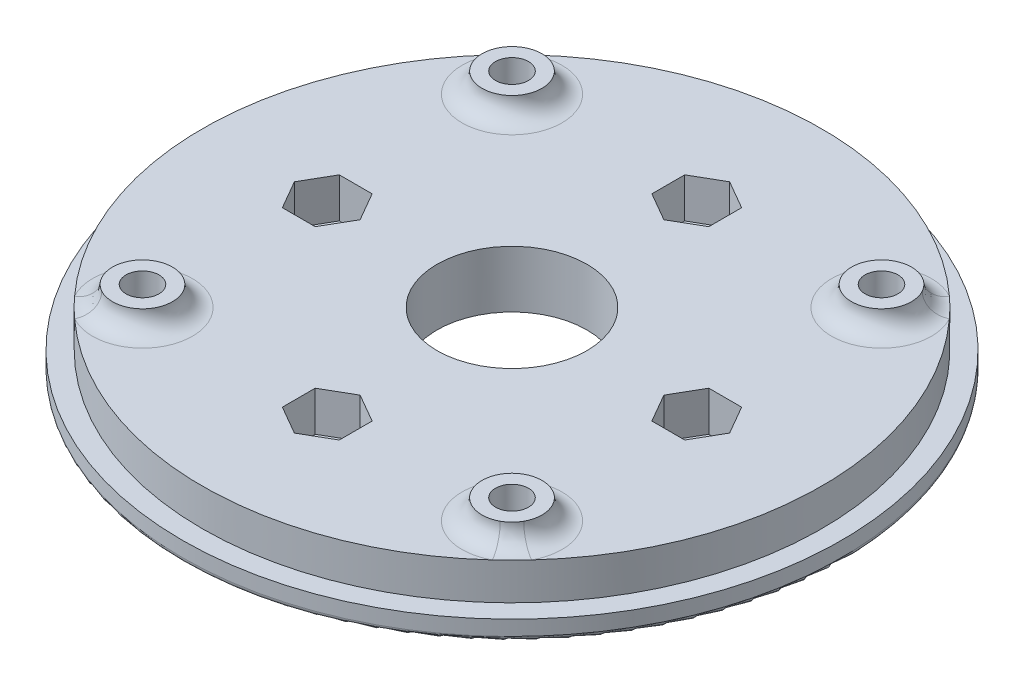
from build123d import *
from build123d.topology import SkipClean

# Parameters (mm, degrees)
SKETCH1_R               = 33
BOSS_EXTRUDE1_DEPTH     = 2
SKETCH4_R               = 31
BOSS_EXTRUDE3_DEPTH     = 3.7
SKETCH5_R               = 1.65
CUT_EXTRUDE1_DEPTH      = 48.015848392
MIRROR4_COPY_1_SKETCH_R = 1.65
MIRROR4_COPY_1_DEPTH    = 48.015848392
SKETCH6_R               = 3
CUT_EXTRUDE2_DEPTH      = 3.5
MIRROR6_COPY_1_SKETCH_R = 3
MIRROR6_COPY_1_DEPTH    = 3.5
FILLET2_R               = 0.5
CUT_EXTRUDE3_DEPTH      = 0.5
BOSS_EXTRUDE4_DEPTH     = 0.2
BOSS_EXTRUDE4_2_DEPTH   = 0.2
MIRROR14_COPY_1_DEPTH   = 0.5
MIRROR18_COPY_1_DEPTH   = 0.2
MIRROR18_COPY_2_DEPTH   = 0.2
BOSS_EXTRUDE5_START     = 2
SKETCH9_R               = 3.001958177
SKETCH9_R_2             = 1.65
BOSS_EXTRUDE5_DEPTH     = 2
CIRPATTERN1_COUNT       = 4
FILLET3_R               = 2
ESBO_O3_R               = 1.8
CORTE_EXTRUS_O2_DEPTH   = 48.015848462
ESPELHAR3_OUTLINE_R     = 1.8
ESPELHAR3_DEPTH         = 5.7
CORTE_EXTRUS_O11_DEPTH  = 3.5
CORTE_EXTRUS_O12_DEPTH  = 0.3
ESBO_O43_W              = 3.6
ESBO_O43_H              = 3.6
CORTE_EXTRUS_O13_DEPTH  = 0.2
ESBO_O44_R              = 7.5
CORTE_EXTRUS_O14_DEPTH  = 48.300000086
CORTE_EXTRUS_O15_DEPTH  = 4
CORTE_EXTRUS_O16_DEPTH  = 4


# Read off the part's stored shape, not the designer's step: Espelhar3
with BuildPart() as part:
    # Sketch1 → Boss-Extrude1 (new body)
    with BuildSketch(Plane(origin=(0, 0, 0), x_dir=(1, 0, 0), z_dir=(0, 1, 0))):
        with Locations(Location((0, 0, 0), (0, 0, 270))):
            Circle(SKETCH1_R)
    extrude(amount=BOSS_EXTRUDE1_DEPTH)

    # Sketch4 → Boss-Extrude3 (add)
    with BuildSketch(Plane(origin=(0, 2, 0), x_dir=(1, 0, 0), z_dir=(0, 1, 0))):
        with Locations(Location((0, 0, 0), (0, 0, 270))):
            Circle(SKETCH4_R)
    extrude(amount=BOSS_EXTRUDE3_DEPTH)

    # Sketch5 → Cut-Extrude1 (cut, through all)
    with BuildSketch(Plane(origin=(0, 5.7, 0), x_dir=(1, 0, 0), z_dir=(0, 1, 0))):
        with Locations(Location((18.5, 18.5, 0), (0, 0, 270))):
            Circle(SKETCH5_R)
    cut_extrude1 = extrude(amount=-CUT_EXTRUDE1_DEPTH, mode=Mode.SUBTRACT)

    # Mirror3: Cut-Extrude1 across plane
    add(cut_extrude1.mirror(Plane(origin=(0, 0, 0), x_dir=(0, 0, 1), z_dir=(1, 0, 0))), mode=Mode.SUBTRACT)

    # Mirror4: Cut-Extrude1 across plane
    add(cut_extrude1.mirror(Plane.XY), mode=Mode.SUBTRACT)

    # Mirror4 copy 1 sketch → Mirror4 copy 1 (cut, through all)
    with BuildSketch(Plane(origin=(0, 5.7, 0), x_dir=(-1, 0, 0), z_dir=(0, 1, 0))):
        with Locations(Location((18.5, 18.5, 0), (0, 0, 270))):
            Circle(MIRROR4_COPY_1_SKETCH_R)
    extrude(amount=-MIRROR4_COPY_1_DEPTH, mode=Mode.SUBTRACT)

    # Sketch6 → Cut-Extrude2 (cut)
    with BuildSketch(Plane.XZ):
        with Locations(Location((18.5, -18.5, 0), (0, 0, 270))):
            Circle(SKETCH6_R)
    cut_extrude2 = extrude(amount=-CUT_EXTRUDE2_DEPTH, mode=Mode.SUBTRACT)

    # Mirror5: Cut-Extrude2 across plane
    add(cut_extrude2.mirror(Plane(origin=(0, 0, 0), x_dir=(0, 0, 1), z_dir=(1, 0, 0))), mode=Mode.SUBTRACT)

    # Mirror6: Cut-Extrude2 across plane
    add(cut_extrude2.mirror(Plane.XY), mode=Mode.SUBTRACT)

    # Mirror6 copy 1 sketch → Mirror6 copy 1 (cut)
    with BuildSketch(Plane(origin=(0, 0, 0), x_dir=(-1, 0, 0), z_dir=(0, -1, 0))):
        with Locations(Location((18.5, -18.5, 0), (0, 0, 270))):
            Circle(MIRROR6_COPY_1_SKETCH_R)
    extrude(amount=-MIRROR6_COPY_1_DEPTH, mode=Mode.SUBTRACT)

    # Fillet2
    fillet2_edges = [part.edges().sort_by_distance(p)[0] for p in [
        (0, 0, -33),
    ]]
    fillet(fillet2_edges, radius=FILLET2_R)

    # Sketch7 → Cut-Extrude3 (cut)
    with BuildSketch(Plane.XZ.offset(-3.5)):
        with BuildLine():
            ThreePointArc((21.5, 18.5), (21.37371553, 19.36125435), (21.005493963, 20.15))
            Line((21.005493963, 20.15), (18.5, 20.15))
            ThreePointArc((18.5, 20.15), (19.666726189, 19.666726189), (20.15, 18.5))
            ThreePointArc((20.15, 18.5), (19.666726189, 17.333273811), (18.5, 16.85))
            Line((18.5, 16.85), (21.005493963, 16.85))
            ThreePointArc((21.005493963, 16.85), (21.37371553, 17.63874565), (21.5, 18.5))
        make_face()
        with BuildLine():
            ThreePointArc((18.5, 16.85), (16.85, 18.5), (18.5, 20.15))
            Line((18.5, 20.15), (15.994506037, 20.15))
            ThreePointArc((15.994506037, 20.15), (15.5, 18.5), (15.994506037, 16.85))
            Line((15.994506037, 16.85), (18.5, 16.85))
        make_face()
    cut_extrude3 = extrude(amount=-CUT_EXTRUDE3_DEPTH, mode=Mode.SUBTRACT)

    # Mirror11: Cut-Extrude3 across plane
    add(cut_extrude3.mirror(Plane.XY), mode=Mode.SUBTRACT)


with BuildPart() as body_2:
    # Sketch8 → Boss-Extrude4 (new body)
    with BuildSketch(Plane(origin=(0, 4, 0), x_dir=(-1, 0, 0), z_dir=(0, -1, 0))):
        with BuildLine():
            Line((-21.005493963, -20.15), (-20.15, -20.15))
            Line((-20.15, -20.15), (-20.15, -16.85))
            Line((-20.15, -16.85), (-21.005493963, -16.85))
            ThreePointArc((-21.005493963, -16.85), (-21.5, -18.5), (-21.005493963, -20.15))
        make_face()
    boss_extrude4 = extrude(amount=BOSS_EXTRUDE4_DEPTH)


with BuildPart() as body_3:
    # Sketch8 → Boss-Extrude4 2 (new body)
    with BuildSketch(Plane(origin=(0, 4, 0), x_dir=(-1, 0, 0), z_dir=(0, -1, 0))):
        with BuildLine():
            Line((-16.85, -16.85), (-16.85, -20.15))
            Line((-16.85, -20.15), (-15.994506037, -20.15))
            ThreePointArc((-15.994506037, -20.15), (-15.5, -18.5), (-15.994506037, -16.85))
            Line((-15.994506037, -16.85), (-16.85, -16.85))
        make_face()
    boss_extrude4_2 = extrude(amount=BOSS_EXTRUDE4_2_DEPTH)


with BuildPart() as part_1:
    add(part.part)

    # Mirror12: Boss-Extrude4, Boss-Extrude4 2 across plane
    add(boss_extrude4.mirror(Plane.XY))
    add(boss_extrude4_2.mirror(Plane.XY))

    # Mirror14: Cut-Extrude3 across plane
    with SkipClean():  # the faces are left unmerged after this step: merging them gives an invalid solid
        add(cut_extrude3.mirror(Plane(origin=(0, 0, 0), x_dir=(0, 0, 1), z_dir=(1, 0, 0))), mode=Mode.SUBTRACT)

    # Mirror14 copy 1 sketch → Mirror14 copy 1 (cut)
    with SkipClean():  # the faces are left unmerged after this step: merging them gives an invalid solid
        with BuildSketch(Plane(origin=(0, 3.5, 0), x_dir=(-1, 0, 0), z_dir=(0, -1, 0))):
            with BuildLine():
                ThreePointArc((21.5, 18.5), (21.37371553, 19.36125435), (21.005493963, 20.15))
                Line((21.005493963, 20.15), (18.5, 20.15))
                ThreePointArc((18.5, 20.15), (19.666726189, 19.666726189), (20.15, 18.5))
                ThreePointArc((20.15, 18.5), (19.666726189, 17.333273811), (18.5, 16.85))
                Line((18.5, 16.85), (21.005493963, 16.85))
                ThreePointArc((21.005493963, 16.85), (21.37371553, 17.63874565), (21.5, 18.5))
            make_face()
            with BuildLine():
                ThreePointArc((18.5, 16.85), (16.85, 18.5), (18.5, 20.15))
                Line((18.5, 20.15), (15.994506037, 20.15))
                ThreePointArc((15.994506037, 20.15), (15.5, 18.5), (15.994506037, 16.85))
                Line((15.994506037, 16.85), (18.5, 16.85))
            make_face()
        extrude(amount=-MIRROR14_COPY_1_DEPTH, mode=Mode.SUBTRACT)

    # Mirror18 copy 1 sketch → Mirror18 copy 1 (add)
    with SkipClean():  # the faces are left unmerged after this step: merging them gives an invalid solid
        with BuildSketch(Plane.XZ.offset(-4)):
            with BuildLine():
                Line((-21.005493963, -20.15), (-20.15, -20.15))
                Line((-20.15, -20.15), (-20.15, -16.85))
                Line((-20.15, -16.85), (-21.005493963, -16.85))
                ThreePointArc((-21.005493963, -16.85), (-21.5, -18.5), (-21.005493963, -20.15))
            make_face()
        extrude(amount=MIRROR18_COPY_1_DEPTH)

    # Mirror18 copy 2 sketch → Mirror18 copy 2 (add)
    with SkipClean():  # the faces are left unmerged after this step: merging them gives an invalid solid
        with BuildSketch(Plane.XZ.offset(-4)):
            with BuildLine():
                Line((-16.85, -16.85), (-16.85, -20.15))
                Line((-16.85, -20.15), (-15.994506037, -20.15))
                ThreePointArc((-15.994506037, -20.15), (-15.5, -18.5), (-15.994506037, -16.85))
                Line((-15.994506037, -16.85), (-16.85, -16.85))
            make_face()
        extrude(amount=MIRROR18_COPY_2_DEPTH)

    # Sketch9 → Boss-Extrude5 (add)
    with SkipClean():  # the faces are left unmerged after this step: merging them gives an invalid solid
        with BuildSketch(Plane(origin=(0, 5.7, 0), x_dir=(1, 0, 0), z_dir=(0, 1, 0)).offset(BOSS_EXTRUDE5_START)):
            with Locations(Location((18.5, 18.5, 0), (0, 0, 270))):
                Circle(SKETCH9_R)
            with Locations(Location((18.5, 18.5, 0), (0, 0, 270))):
                Circle(SKETCH9_R_2, mode=Mode.SUBTRACT)
        boss_extrude5 = extrude(amount=-BOSS_EXTRUDE5_DEPTH)

    # CirPattern1: Boss-Extrude5 ×4 about axis
    with SkipClean():  # the faces are left unmerged after this step: merging them gives an invalid solid
        cirpattern1_axis = Axis((0, 0, 0), (0, 1, 0))
        for i in range(1, CIRPATTERN1_COUNT):
            add(boss_extrude5.rotate(cirpattern1_axis, i * 360 / CIRPATTERN1_COUNT))

    # Fillet3
    fillet3_edges = [part_1.edges().sort_by_distance(p)[0] for p in [
        (18.5, 5.7, -21.501958177),
        (-21.501958177, 5.7, -18.5),
        (-18.5, 5.7, 21.501958177),
        (21.501958177, 5.7, 18.5),
    ]]
    fillet(fillet3_edges, radius=FILLET3_R - 0.0001)  # a hair under: the kernel refuses the full size

    # Esboço3 → Corte-extrusão2 (cut, through all)
    with BuildSketch(Plane(origin=(0, 5.7, 0), x_dir=(1, 0, 0), z_dir=(0, 1, 0))):
        with Locations(Location((-18.5, 0, 0), (0, 0, 270))):
            Circle(ESBO_O3_R)
    corte_extrus_o2 = extrude(amount=-CORTE_EXTRUS_O2_DEPTH, mode=Mode.SUBTRACT)

    # Espelhar1: Corte-extrusão2 across plane
    add(corte_extrus_o2.mirror(Plane(origin=(0, 0, 0), x_dir=(0, 0, 1), z_dir=(1, 0, 0))), mode=Mode.SUBTRACT)

    # Espelhar2: Corte-extrusão2 across plane
    add(corte_extrus_o2.mirror(Plane(origin=(0, 0, 0), x_dir=(-0.7071067811865477, 0, 0.7071067811865474), z_dir=(0.7071067811865476, 0, 0.7071067811865476))), mode=Mode.SUBTRACT)

    # Espelhar3 outline → Espelhar3 (cut)
    with BuildSketch(Plane(origin=(0, 0, 0), x_dir=(1, 0, 0), z_dir=(0, 1, 0))):
        with Locations((0, 18.5)):
            Circle(ESPELHAR3_OUTLINE_R)
    extrude(amount=ESPELHAR3_DEPTH, mode=Mode.SUBTRACT)

    # Esboço41 → Corte-extrusão11 (cut)
    with BuildSketch(Plane(origin=(0, 5.7, 0), x_dir=(1, 0, 0), z_dir=(0, 1, 0))):
        Polygon((-16.854551733, 2.85), (-20.145448267, 2.85), (-21.790896534, 0), (-20.145448267, -2.85), (-16.854551733, -2.85), (-15.209103466, 0), align=None)
    corte_extrus_o11 = extrude(amount=-CORTE_EXTRUS_O11_DEPTH, mode=Mode.SUBTRACT)

    # Esboço42 → Corte-extrusão12 (cut)
    with BuildSketch(Plane(origin=(0, 2.2, 0), x_dir=(1, 0, 0), z_dir=(0, 1, 0))):
        Polygon((-20.75166605, -1.8), (-16.24833395, -1.8), (-15.209103466, 0), (-16.24833395, 1.8), (-20.75166605, 1.8), (-21.790896534, 0), align=None)
    corte_extrus_o12 = extrude(amount=-CORTE_EXTRUS_O12_DEPTH, mode=Mode.SUBTRACT)

    # Esboço43 → Corte-extrusão13 (cut)
    with BuildSketch(Plane(origin=(0, 1.9, 0), x_dir=(1, 0, 0), z_dir=(0, 1, 0))):
        with Locations((-18.5, 0)):
            Rectangle(ESBO_O43_W, ESBO_O43_H)
    corte_extrus_o13 = extrude(amount=-CORTE_EXTRUS_O13_DEPTH, mode=Mode.SUBTRACT)

    # Espelhar8: Corte-extrusão11, Corte-extrusão12, Corte-extrusão13 across plane
    add(corte_extrus_o11.mirror(Plane(origin=(0, 0, 0), x_dir=(0, 0, 1), z_dir=(1, 0, 0))), mode=Mode.SUBTRACT)
    add(corte_extrus_o12.mirror(Plane(origin=(0, 0, 0), x_dir=(0, 0, 1), z_dir=(1, 0, 0))), mode=Mode.SUBTRACT)
    add(corte_extrus_o13.mirror(Plane(origin=(0, 0, 0), x_dir=(0, 0, 1), z_dir=(1, 0, 0))), mode=Mode.SUBTRACT)

    # Espelhar9: Corte-extrusão11, Corte-extrusão12, Corte-extrusão13 across plane
    add(corte_extrus_o11.mirror(Plane(origin=(0, 0, 0), x_dir=(-0.7071067811865477, 0, 0.7071067811865474), z_dir=(0.7071067811865476, 0, 0.7071067811865476))), mode=Mode.SUBTRACT)
    add(corte_extrus_o12.mirror(Plane(origin=(0, 0, 0), x_dir=(-0.7071067811865477, 0, 0.7071067811865474), z_dir=(0.7071067811865476, 0, 0.7071067811865476))), mode=Mode.SUBTRACT)
    add(corte_extrus_o13.mirror(Plane(origin=(0, 0, 0), x_dir=(-0.7071067811865477, 0, 0.7071067811865474), z_dir=(0.7071067811865476, 0, 0.7071067811865476))), mode=Mode.SUBTRACT)

    # Espelhar10: Corte-extrusão11, Corte-extrusão12, Corte-extrusão13 across plane
    with SkipClean():  # the faces are left unmerged after this step: merging them gives an invalid solid
        add(corte_extrus_o11.mirror(Plane(origin=(0, 0, 0), x_dir=(0.7071067811865478, 0, 0.7071067811865472), z_dir=(-0.7071067811865475, 0, 0.7071067811865477))), mode=Mode.SUBTRACT)
        add(corte_extrus_o12.mirror(Plane(origin=(0, 0, 0), x_dir=(0.7071067811865478, 0, 0.7071067811865472), z_dir=(-0.7071067811865475, 0, 0.7071067811865477))), mode=Mode.SUBTRACT)
        add(corte_extrus_o13.mirror(Plane(origin=(0, 0, 0), x_dir=(0.7071067811865478, 0, 0.7071067811865472), z_dir=(-0.7071067811865475, 0, 0.7071067811865477))), mode=Mode.SUBTRACT)

    # Esboço44 → Corte-extrusão14 (cut, through all)
    with BuildSketch(Plane.XZ):
        with Locations(Location((0, 0, 0), (0, 0, 270))):
            Circle(ESBO_O44_R)
    extrude(amount=-CORTE_EXTRUS_O14_DEPTH, mode=Mode.SUBTRACT)

    # Espelhar11: Boss-Extrude4, Boss-Extrude4 2 across plane
    add(boss_extrude4.mirror(Plane(origin=(0, 0, 0), x_dir=(0, 0, 1), z_dir=(1, 0, 0))))
    add(boss_extrude4_2.mirror(Plane(origin=(0, 0, 0), x_dir=(0, 0, 1), z_dir=(1, 0, 0))))

    # Esboço47 → Corte-extrusão15 (cut)
    with BuildSketch(Plane(origin=(0, 1.7, 0), x_dir=(1, 0, 0), z_dir=(0, 1, 0))):
        Polygon((-15.209103466, 0), (-16.854551733, 2.85), (-20.145448267, 2.85), (-21.790896534, 0), (-20.145448267, -2.85), (-16.854551733, -2.85), align=None)
    corte_extrus_o15 = extrude(amount=CORTE_EXTRUS_O15_DEPTH, mode=Mode.SUBTRACT)

    # Espelhar12: Corte-extrusão15 across plane
    add(corte_extrus_o15.mirror(Plane(origin=(0, 0, 0), x_dir=(0, 0, 1), z_dir=(1, 0, 0))), mode=Mode.SUBTRACT)

    # Esboço48 → Corte-extrusão16 (cut)
    with BuildSketch(Plane(origin=(0, 1.7, 0), x_dir=(1, 0, 0), z_dir=(0, 1, 0))):
        Polygon((-2.85, -16.854551733), (0, -15.209103466), (2.85, -16.854551733), (2.85, -20.145448267), (0, -21.790896534), (-2.85, -20.145448267), align=None)
    corte_extrus_o16 = extrude(amount=CORTE_EXTRUS_O16_DEPTH, mode=Mode.SUBTRACT)

    # Espelhar13: Corte-extrusão16 across plane
    add(corte_extrus_o16.mirror(Plane.XY), mode=Mode.SUBTRACT)


solid = Compound([body_2.part, body_3.part, part_1.part])
